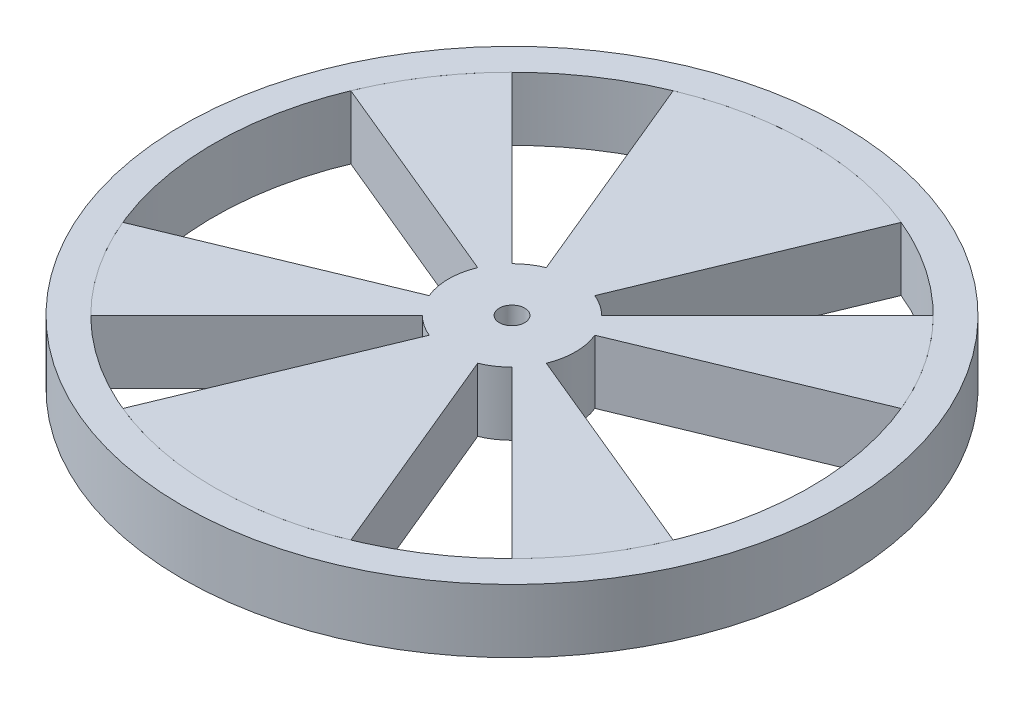
from build123d import *

# Parameters (mm, degrees)
SKETCH2_R           = 26
BOSS_EXTRUDE1_DEPTH = 5
SKETCH4_R           = 23.5
CUT_EXTRUDE2_DEPTH  = 7
SKETCH3_5_R         = 1
BOSS_EXTRUDE3_DEPTH = 5


with BuildPart() as part:
    # Sketch2 → Boss-Extrude1 (new body)
    with BuildSketch(Plane(origin=(0, 0, 0), x_dir=(1, 0, 0), z_dir=(0, 1, 0))):
        Circle(SKETCH2_R)
    extrude(amount=BOSS_EXTRUDE1_DEPTH)

    # Sketch4 → Cut-Extrude2 (cut)
    with BuildSketch(Plane(origin=(0, 5, 0), x_dir=(1, 0, 0), z_dir=(0, 1, 0))):
        Circle(SKETCH4_R)
    extrude(amount=-CUT_EXTRUDE2_DEPTH, mode=Mode.SUBTRACT)


with BuildPart() as body_2:
    # Sketch3<5> → Boss-Extrude3 (new body)
    with BuildSketch(Plane(origin=(0, 5, 0), x_dir=(1, 0, 0), z_dir=(0, 1, 0))):
        with BuildLine():
            ThreePointArc((-4.619397663, 1.913417162), (-5, 0), (-4.619397663, -1.913417162))
            Line((-4.619397663, -1.913417162), (-21.711169014, -8.993060661))
            ThreePointArc((-21.711169014, -8.993060661), (-19.539535889, -13.055900476), (-16.617009358, -16.617009358))
            Line((-16.617009358, -16.617009358), (-3.535533906, -3.535533906))
            ThreePointArc((-3.535533906, -3.535533906), (-2.777851165, -4.157348062), (-1.913417162, -4.619397663))
            Line((-1.913417162, -4.619397663), (-8.993060661, -21.711169014))
            ThreePointArc((-8.993060661, -21.711169014), (0, -23.5), (8.993060661, -21.711169014))
            Line((8.993060661, -21.711169014), (1.913417162, -4.619397663))
            ThreePointArc((1.913417162, -4.619397663), (2.777851165, -4.157348062), (3.535533906, -3.535533906))
            Line((3.535533906, -3.535533906), (16.617009358, -16.617009358))
            ThreePointArc((16.617009358, -16.617009358), (19.539535889, -13.055900476), (21.711169014, -8.993060661))
            Line((21.711169014, -8.993060661), (4.619397663, -1.913417162))
            ThreePointArc((4.619397663, -1.913417162), (5, 0), (4.619397663, 1.913417162))
            Line((4.619397663, 1.913417162), (21.711169014, 8.993060661))
            ThreePointArc((21.711169014, 8.993060661), (19.539535889, 13.055900476), (16.617009358, 16.617009358))
            Line((16.617009358, 16.617009358), (3.535533906, 3.535533906))
            ThreePointArc((3.535533906, 3.535533906), (2.777851165, 4.157348062), (1.913417162, 4.619397663))
            Line((1.913417162, 4.619397663), (8.993060661, 21.711169014))
            ThreePointArc((8.993060661, 21.711169014), (0, 23.5), (-8.993060661, 21.711169014))
            Line((-8.993060661, 21.711169014), (-1.913417162, 4.619397663))
            ThreePointArc((-1.913417162, 4.619397663), (-2.777851165, 4.157348062), (-3.535533906, 3.535533906))
            Line((-3.535533906, 3.535533906), (-16.617009358, 16.617009358))
            ThreePointArc((-16.617009358, 16.617009358), (-19.539535889, 13.055900476), (-21.711169014, 8.993060661))
            Line((-21.711169014, 8.993060661), (-4.619397663, 1.913417162))
        make_face()
        Circle(SKETCH3_5_R, mode=Mode.SUBTRACT)
    extrude(amount=-BOSS_EXTRUDE3_DEPTH)


solid = Compound([part.part, body_2.part])
